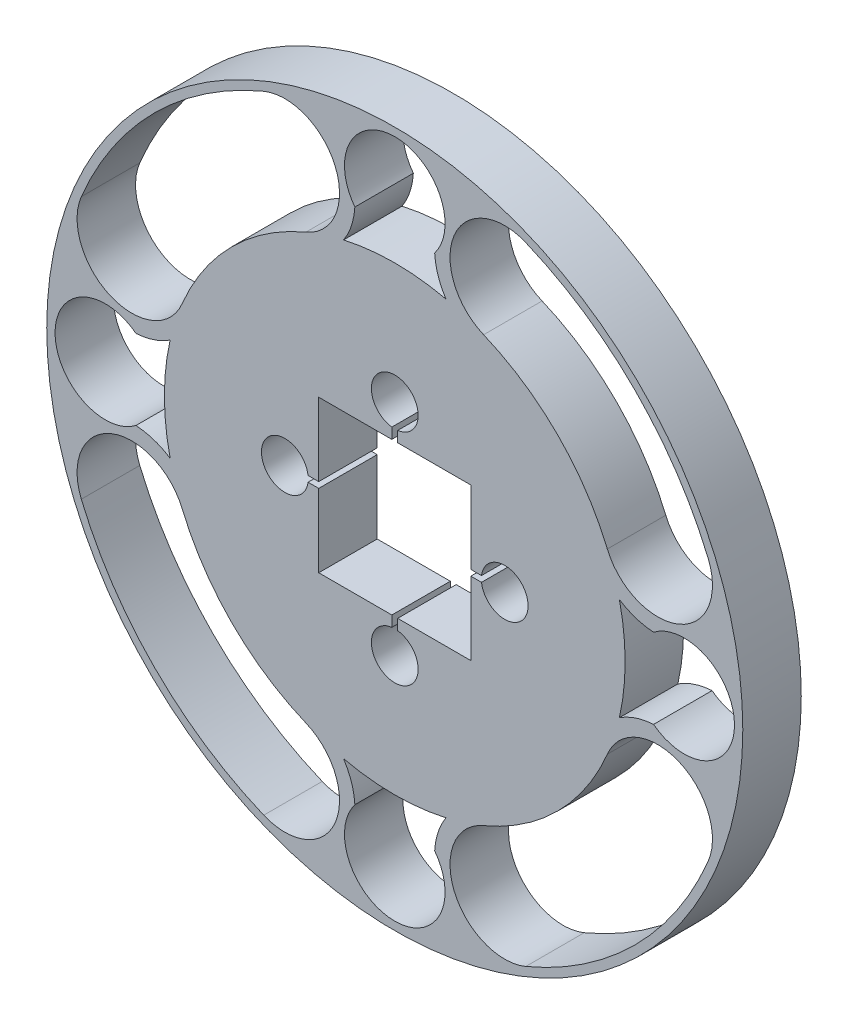
from build123d import *

# Parameters (mm, degrees)
SKETCH1_R           = 37.7952
BOSS_EXTRUDE1_DEPTH = 6.35


with BuildPart() as part:
    # Sketch1 → Boss-Extrude1 (new body)
    with BuildSketch(Plane.XY):
        Circle(SKETCH1_R)
        with BuildLine():
            ThreePointArc((-34.039747326, -14.227647179), (-30.851397302, -6.460002797), (-23.08375292, -9.648352821))
            ThreePointArc((-23.08375292, -9.648352821), (-17.691104559, -17.691104559), (-9.648352821, -23.08375292))
            ThreePointArc((-9.648352821, -23.08375292), (-6.460002797, -30.851397302), (-14.227647179, -34.039747326))
            ThreePointArc((-14.227647179, -34.039747326), (-26.087644032, -26.087644032), (-34.039747326, -14.227647179))
        make_face(mode=Mode.SUBTRACT)
        with BuildLine():
            ThreePointArc((4.331589615, -28.106864361), (5.170944396, -29.676409155), (5.461, -31.4325))
            ThreePointArc((5.461, -31.4325), (-1.756090845, -36.603444396), (-4.331589615, -28.106864361))
            ThreePointArc((-4.331589615, -28.106864361), (-4.703044169, -26.170136834), (-5.559063479, -24.393588794))
            ThreePointArc((-5.559063479, -24.393588794), (0, -25.019), (5.559063479, -24.393588794))
            ThreePointArc((5.559063479, -24.393588794), (4.703044169, -26.170136834), (4.331589615, -28.106864361))
        make_face(mode=Mode.SUBTRACT)
        with BuildLine():
            ThreePointArc((14.227647179, -34.039747326), (6.460002797, -30.851397302), (9.648352821, -23.08375292))
            ThreePointArc((9.648352821, -23.08375292), (17.691104559, -17.691104559), (23.08375292, -9.648352821))
            ThreePointArc((23.08375292, -9.648352821), (30.851397302, -6.460002797), (34.039747326, -14.227647179))
            ThreePointArc((34.039747326, -14.227647179), (26.087644032, -26.087644032), (14.227647179, -34.039747326))
        make_face(mode=Mode.SUBTRACT)
        with BuildLine():
            ThreePointArc((-28.106864361, -4.331589615), (-36.8935, 0), (-28.106864361, 4.331589615))
            ThreePointArc((-28.106864361, 4.331589615), (-26.170136834, 4.703044169), (-24.393588794, 5.559063479))
            ThreePointArc((-24.393588794, 5.559063479), (-25.019, 0), (-24.393588794, -5.559063479))
            ThreePointArc((-24.393588794, -5.559063479), (-26.170136834, -4.703044169), (-28.106864361, -4.331589615))
        make_face(mode=Mode.SUBTRACT)
        with BuildLine():
            ThreePointArc((-23.08375292, 9.648352821), (-30.851397302, 6.460002797), (-34.039747326, 14.227647179))
            ThreePointArc((-34.039747326, 14.227647179), (-26.087644032, 26.087644032), (-14.227647179, 34.039747326))
            ThreePointArc((-14.227647179, 34.039747326), (-6.460002797, 30.851397302), (-9.648352821, 23.08375292))
            ThreePointArc((-9.648352821, 23.08375292), (-17.691104559, 17.691104559), (-23.08375292, 9.648352821))
        make_face(mode=Mode.SUBTRACT)
        with BuildLine():
            Line((-8.255, 0.3175), (-8.255, 8.255))
            Line((-8.255, 8.255), (-0.3175, 8.255))
            Line((-0.3175, 8.255), (-0.3175, 9.417921876))
            ThreePointArc((-0.3175, 9.417921876), (-1.680052083, 13.843), (2.54, 11.938))
            ThreePointArc((2.54, 11.938), (1.905, 10.257947917), (0.3175, 9.417921876))
            Line((0.3175, 9.417921876), (0.3175, 8.255))
            Line((0.3175, 8.255), (8.255, 8.255))
            Line((8.255, 8.255), (8.255, 0.3175))
            Line((8.255, 0.3175), (9.417921876, 0.3175))
            ThreePointArc((9.417921876, 0.3175), (12.097062198, 2.535014638), (14.478, 0))
            ThreePointArc((14.478, 0), (12.097062198, -2.535014638), (9.417921876, -0.3175))
            Line((9.417921876, -0.3175), (8.255, -0.3175))
            Line((8.255, -0.3175), (8.255, -8.255))
            Line((8.255, -8.255), (0.3175, -8.255))
            Line((0.3175, -8.255), (0.3175, -9.417921876))
            ThreePointArc((0.3175, -9.417921876), (1.905, -10.257947917), (2.54, -11.938))
            ThreePointArc((2.54, -11.938), (-1.680052083, -13.843), (-0.3175, -9.417921876))
            Line((-0.3175, -9.417921876), (-0.3175, -8.255))
            Line((-0.3175, -8.255), (-8.255, -8.255))
            Line((-8.255, -8.255), (-8.255, -0.3175))
            Line((-8.255, -0.3175), (-9.417921876, -0.3175))
            ThreePointArc((-9.417921876, -0.3175), (-14.478, 0), (-9.417921876, 0.3175))
            Line((-9.417921876, 0.3175), (-8.255, 0.3175))
        make_face(mode=Mode.SUBTRACT)
        with BuildLine():
            ThreePointArc((28.106864361, 4.331589615), (36.8935, 0), (28.106864361, -4.331589615))
            ThreePointArc((28.106864361, -4.331589615), (26.170136834, -4.703044169), (24.393588794, -5.559063479))
            ThreePointArc((24.393588794, -5.559063479), (25.019, 0), (24.393588794, 5.559063479))
            ThreePointArc((24.393588794, 5.559063479), (26.170136834, 4.703044169), (28.106864361, 4.331589615))
        make_face(mode=Mode.SUBTRACT)
        with BuildLine():
            ThreePointArc((-4.331589615, 28.106864361), (0, 36.8935), (4.331589615, 28.106864361))
            ThreePointArc((4.331589615, 28.106864361), (4.703044169, 26.170136834), (5.559063479, 24.393588794))
            ThreePointArc((5.559063479, 24.393588794), (0, 25.019), (-5.559063479, 24.393588794))
            ThreePointArc((-5.559063479, 24.393588794), (-4.703044169, 26.170136834), (-4.331589615, 28.106864361))
        make_face(mode=Mode.SUBTRACT)
        with BuildLine():
            ThreePointArc((34.039747326, 14.227647179), (30.851397302, 6.460002797), (23.08375292, 9.648352821))
            ThreePointArc((23.08375292, 9.648352821), (17.691104559, 17.691104559), (9.648352821, 23.08375292))
            ThreePointArc((9.648352821, 23.08375292), (6.460002797, 30.851397302), (14.227647179, 34.039747326))
            ThreePointArc((14.227647179, 34.039747326), (26.087644032, 26.087644032), (34.039747326, 14.227647179))
        make_face(mode=Mode.SUBTRACT)
    extrude(amount=BOSS_EXTRUDE1_DEPTH)


solid = part.part
